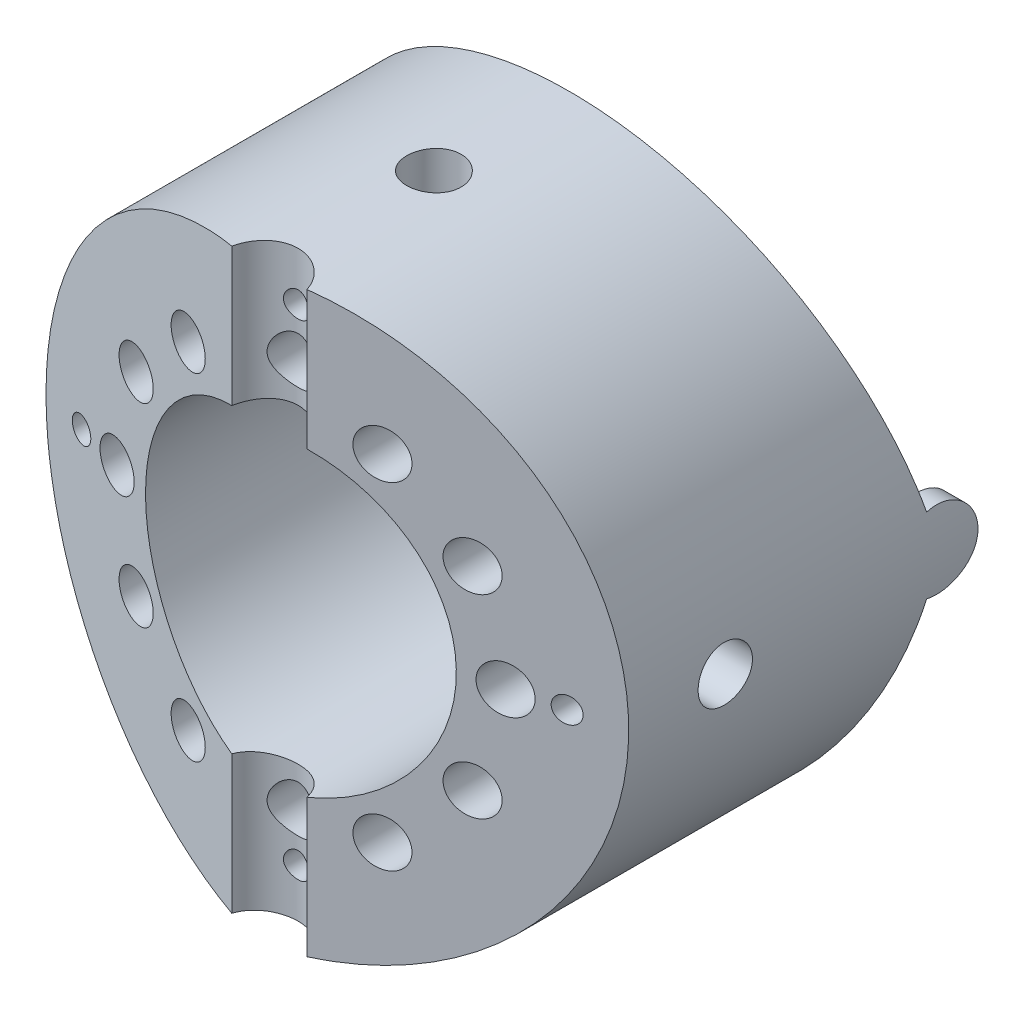
from build123d import *
from build123d.topology import SkipClean

# Parameters (mm, degrees)
SKETCH_1_R                       = 7.5
EXTRUDE_1_DEPTH                  = 10
CUT_EXTRUDE_1_DEPTH              = 15.577379737
CUT_EXTRUDE_1_DEPTH_BACK         = 15.577379737
CUT_EXTRUDE_2_DEPTH              = 15.577379737
CUT_EXTRUDE_2_DEPTH_BACK         = 15.577379737
EXTRUDE_2_REACH                  = 16.577
EXTRUDE_2_END_RADIUS             = 7.5
SKETCH_6_R                       = 1
EXTRUDE_2_DIRECTION_2_REACH      = 16.577
EXTRUDE_2_DIRECTION_2_END_RADIUS = 7.5
CUT_EXTRUDE_7_DEPTH              = 15.577379909
CUT_EXTRUDE_7_DEPTH_BACK         = 15.577379909
SKETCH_7_R                       = 1
CUT_EXTRUDE_9_DEPTH              = 15.401062864
CUT_EXTRUDE_9_DEPTH_BACK         = 15.401062864
SKETCH_8_R                       = 4
CUT_EXTRUDE_10_DEPTH             = 15.401062882
CUT_EXTRUDE_10_DEPTH_BACK        = 15.401062882
SKETCH_9_R                       = 0.6
CUT_EXTRUDE_11_DEPTH             = 15.401062882
CUT_EXTRUDE_11_DEPTH_BACK        = 15.401062882
SKETCH_10_R                      = 0.325
SKETCH_11_W                      = 2.5
SKETCH_11_H                      = 2
CUT_EXTRUDE_12_DEPTH             = 1
SKETCH_12_R                      = 0.7
CUT_EXTRUDE_13_DEPTH             = 1.25
PATTERN_CIRCULAR_1_COUNT         = 4


with BuildPart() as part:
    # 草图1 → 凸台-拉伸1 (new body)
    with BuildSketch(Plane.XY):
        Circle(SKETCH_1_R)
    extrude(amount=EXTRUDE_1_DEPTH)

    # 草图2 → 切除-拉伸1 (cut, two sides: drawn at the far end of the back side and taken through both)
    with BuildSketch(Plane(origin=(0, 0, 0), x_dir=(0, 0, -1), z_dir=(1, 0, 0)).offset(-CUT_EXTRUDE_1_DEPTH_BACK)):
        Polygon((-2.009618943, 7.5), (0, 0), (0, 7.5), align=None)
        Polygon((0, -7.5), (0, 0), (-2.009618943, -7.5), align=None)
    extrude(amount=CUT_EXTRUDE_1_DEPTH + CUT_EXTRUDE_1_DEPTH_BACK, mode=Mode.SUBTRACT)

    # 草图3 → 切除-拉伸2 (cut, two sides: drawn at the far end of the back side and taken through both)
    with BuildSketch(Plane(origin=(0, 0, 0), x_dir=(1, 0, 0), z_dir=(0, 1, 0)).offset(-CUT_EXTRUDE_2_DEPTH_BACK)):
        Polygon((7.5, -7.990381057), (0, -10), (7.5, -10), align=None)
        Polygon((-7.5, -10), (0, -10), (-7.5, -7.990381057), align=None)
    extrude(amount=CUT_EXTRUDE_2_DEPTH + CUT_EXTRUDE_2_DEPTH_BACK, mode=Mode.SUBTRACT)

    # 凸台-拉伸2: up to this cylinder (the profile starts inside it)
    extrude_2_end = Plane(origin=(0, 0, 0), z_dir=(0, 0, -1)) * Cylinder(EXTRUDE_2_END_RADIUS, 49.154, mode=Mode.PRIVATE)
    # 草图6 → 凸台-拉伸2 (add, up to the surface)
    with BuildSketch(Plane(origin=(0, 0, 0), x_dir=(0, 0, -1), z_dir=(1, 0, 0)), mode=Mode.PRIVATE) as extrude_2_sk1:
        Circle(SKETCH_6_R)
    extrude_2_tool1 = extrude(extrude_2_sk1.sketch, amount=-EXTRUDE_2_REACH, mode=Mode.PRIVATE) & extrude_2_end
    add(extrude_2_tool1.solids().sort_by_distance((0, 0, 0))[0])

    # 凸台-拉伸2 direction 2: up to this cylinder (the profile starts inside it)
    with SkipClean():  # the faces are left unmerged after this step: merging them gives an invalid solid
        extrude_2_direction_2_end = Plane(origin=(0, 0, 0), z_dir=(0, 0, -1)) * Cylinder(EXTRUDE_2_DIRECTION_2_END_RADIUS, 49.154, mode=Mode.PRIVATE)
        # 草图6 → 凸台-拉伸2 direction 2 (add, up to the surface)
        with BuildSketch(Plane(origin=(0, 0, 0), x_dir=(0, 0, -1), z_dir=(1, 0, 0)), mode=Mode.PRIVATE) as extrude_2_direction_2_sk1:
            Circle(SKETCH_6_R)
        extrude_2_direction_2_tool1 = extrude(extrude_2_direction_2_sk1.sketch, amount=EXTRUDE_2_DIRECTION_2_REACH, mode=Mode.PRIVATE) & extrude_2_direction_2_end
        add(extrude_2_direction_2_tool1.solids().sort_by_distance((0, 0, 0))[0])
    add(part.part.scale(1), mode=Mode.REPLACE)  # the faces are merged on a copy

    # 草图7 → 切除-拉伸7 (cut, two sides: drawn at the far end of the back side and taken through both)
    with BuildSketch(Plane(origin=(0, 0, 0), x_dir=(1, 0, 0), z_dir=(0, 1, 0)).offset(-CUT_EXTRUDE_7_DEPTH_BACK)):
        with Locations((0, -10)):
            Circle(SKETCH_7_R)
    extrude(amount=CUT_EXTRUDE_7_DEPTH + CUT_EXTRUDE_7_DEPTH_BACK, mode=Mode.SUBTRACT)

    # 草图8 → 切除-拉伸9 (cut, two sides: drawn at the far end of the back side and taken through both)
    with BuildSketch(Plane.XY.offset(-CUT_EXTRUDE_9_DEPTH_BACK)):
        Circle(SKETCH_8_R)
    extrude(amount=CUT_EXTRUDE_9_DEPTH + CUT_EXTRUDE_9_DEPTH_BACK, mode=Mode.SUBTRACT)

    # 草图9 → 切除-拉伸10 (cut, two sides: drawn at the far end of the back side and taken through both)
    with BuildSketch(Plane.XY.offset(-CUT_EXTRUDE_10_DEPTH_BACK)):
        with Locations((-5, 0)):
            Circle(SKETCH_9_R)
        with Locations((-4.330127019, 2.5)):
            Circle(SKETCH_9_R)
        with Locations((-2.5, 4.330127019)):
            Circle(SKETCH_9_R)
        with Locations((0, 5)):
            Circle(SKETCH_9_R)
        with Locations((2.5, 4.330127019)):
            Circle(SKETCH_9_R)
        with Locations((4.330127019, 2.5)):
            Circle(SKETCH_9_R)
        with Locations((5, 0)):
            Circle(SKETCH_9_R)
        with Locations((4.330127019, -2.5)):
            Circle(SKETCH_9_R)
        with Locations((2.5, -4.330127019)):
            Circle(SKETCH_9_R)
        with Locations((0, -5)):
            Circle(SKETCH_9_R)
        with Locations((-2.5, -4.330127019)):
            Circle(SKETCH_9_R)
        with Locations((-4.330127019, -2.5)):
            Circle(SKETCH_9_R)
    extrude(amount=CUT_EXTRUDE_10_DEPTH + CUT_EXTRUDE_10_DEPTH_BACK, mode=Mode.SUBTRACT)

    # 草图10 → 切除-拉伸11 (cut, two sides: drawn at the far end of the back side and taken through both)
    with BuildSketch(Plane.XY.offset(-CUT_EXTRUDE_11_DEPTH_BACK)):
        with Locations((-6.25, 0)):
            Circle(SKETCH_10_R)
        with Locations((0, 6.25)):
            Circle(SKETCH_10_R)
        with Locations((6.25, 0)):
            Circle(SKETCH_10_R)
        with Locations((0, -6.25)):
            Circle(SKETCH_10_R)
    extrude(amount=CUT_EXTRUDE_11_DEPTH + CUT_EXTRUDE_11_DEPTH_BACK, mode=Mode.SUBTRACT)

    # 草图11 → 切除-拉伸12 (cut)
    with BuildSketch(Plane(origin=(0, 0, -1), x_dir=(-1, 0, 0), z_dir=(0, 0, -1))):
        with Locations((-5.659580399, 0)):
            Rectangle(SKETCH_11_W, SKETCH_11_H)
        with Locations((5.659580399, 0)):
            Rectangle(SKETCH_11_W, SKETCH_11_H)
    extrude(amount=-CUT_EXTRUDE_12_DEPTH, mode=Mode.SUBTRACT)

    # 草图12 → 切除-拉伸13 (cut)
    with BuildSketch(Plane(origin=(0, -7.5, 0), x_dir=(-1, 0, 0), z_dir=(0, -1, 0))):
        with Locations((0, -5.504809472)):
            Circle(SKETCH_12_R)
    cut_extrude_13 = extrude(amount=-CUT_EXTRUDE_13_DEPTH, mode=Mode.SUBTRACT)

    # 阵列(圆周)1: 切除-拉伸13 ×4 about axis
    pattern_circular_1_axis = Axis((0, 0, 10), (0, 0, -1))
    for i in range(1, PATTERN_CIRCULAR_1_COUNT):
        add(cut_extrude_13.rotate(pattern_circular_1_axis, i * 360 / PATTERN_CIRCULAR_1_COUNT), mode=Mode.SUBTRACT)


solid = part.part
